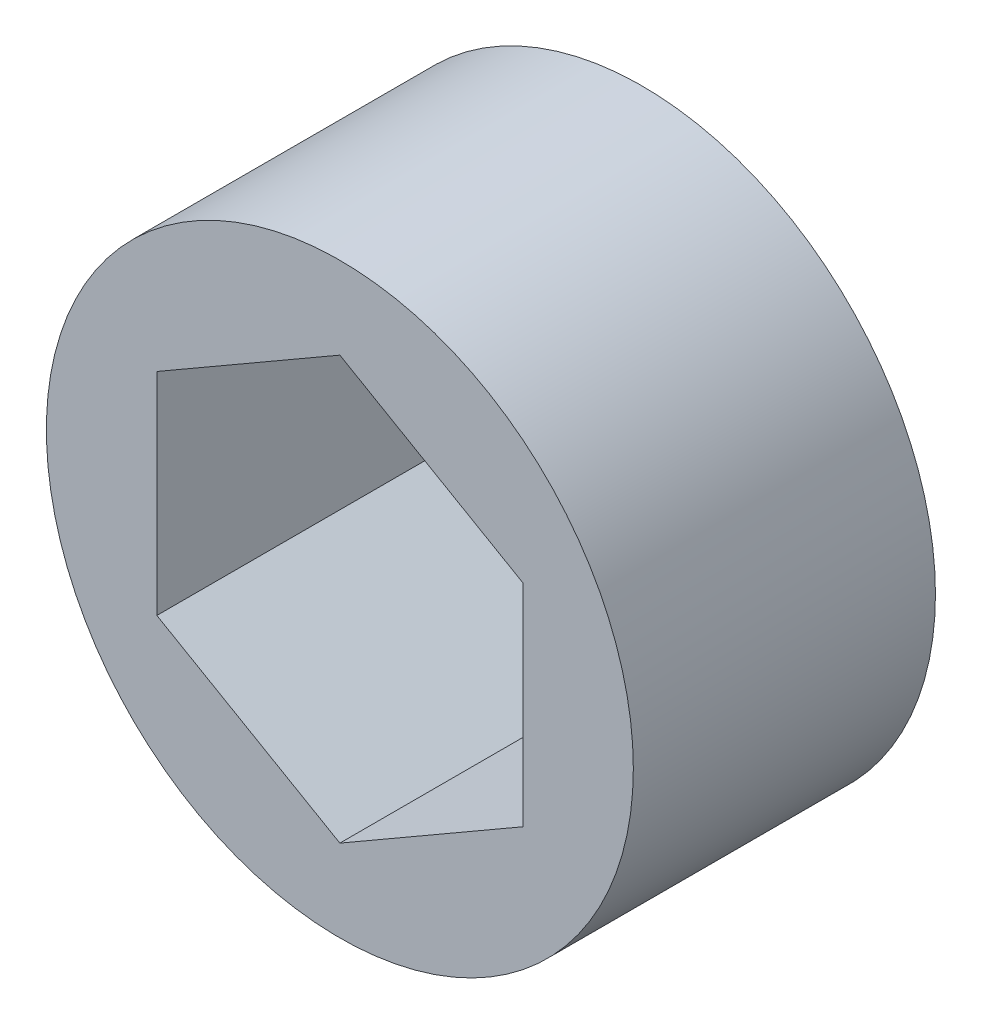
from build123d import *

# Parameters (mm, degrees)
SKETCH1_R           = 10.795
BOSS_EXTRUDE1_DEPTH = 11.1125


with BuildPart() as part:
    # Sketch1 → Boss-Extrude1 (new body)
    with BuildSketch(Plane.XY):
        Circle(SKETCH1_R)
        Polygon((6.731, 3.886144662), (0, 7.772289324), (-6.731, 3.886144662), (-6.731, -3.886144662), (0, -7.772289324), (6.731, -3.886144662), align=None, mode=Mode.SUBTRACT)
    extrude(amount=BOSS_EXTRUDE1_DEPTH)


solid = part.part
